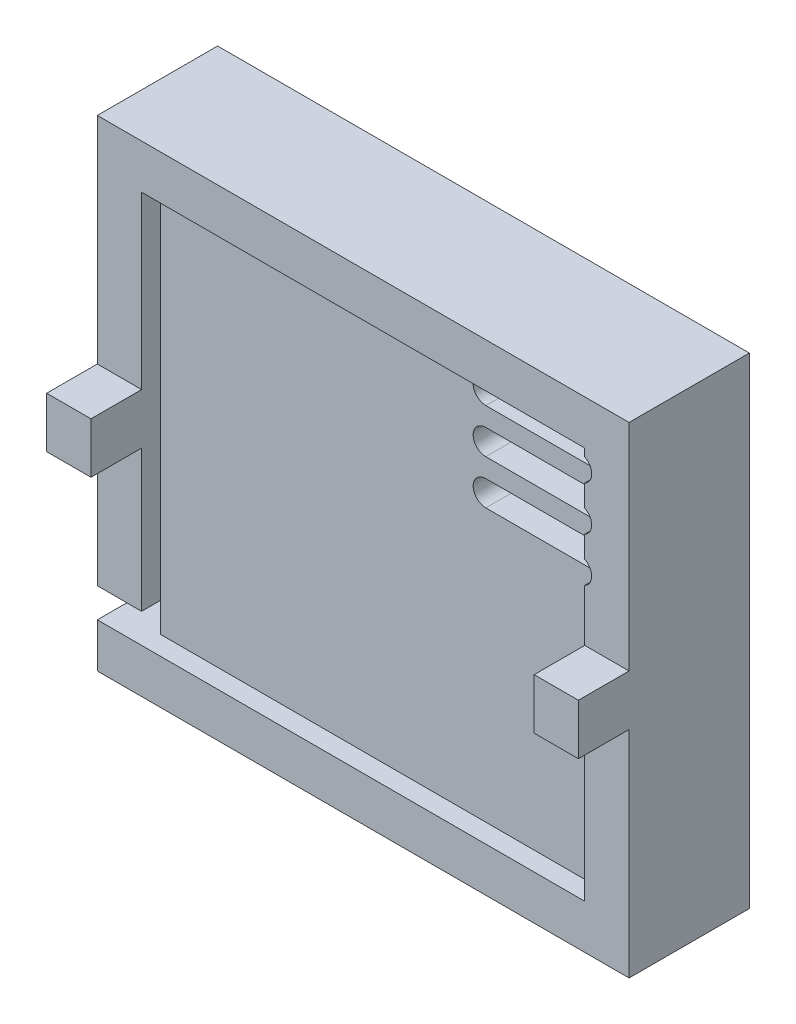
from build123d import *

# Parameters (mm, degrees)
SKETCH_1_W          = 42
SKETCH_1_H          = 38
EXTRUDE_1_DEPTH     = 3.5
SKETCH_2_W          = 3.5
SKETCH_2_H          = 4
EXTRUDE_2_DEPTH     = 4
SKETCH_3_W          = 35
SKETCH_3_H          = 31
CUT_EXTRUDE_1_DEPTH = 1.5
SKETCH_4_W          = 42
SKETCH_4_H          = 38
SKETCH_4_W_2        = 35
SKETCH_4_H_2        = 31
EXTRUDE_3_DEPTH     = 4
SKETCH_6_W          = 42
SKETCH_6_H          = 38
EXTRUDE_4_DEPTH     = 2
SKETCH_7_W          = 4
SKETCH_7_H          = 25
CUT_EXTRUDE_2_DEPTH = 3.5
SKETCH_8_W          = 3.5
SKETCH_8_H          = 2.331830178
CUT_EXTRUDE_3_DEPTH = 3.5
CUT_EXTRUDE_4_DEPTH = 10
SKETCH_10_W         = 1.5
SKETCH_10_H         = 31
EXTRUDE_5_DEPTH     = 5


with BuildPart() as part:
    # 草图1 → 凸台-拉伸1 (new body)
    with BuildSketch(Plane.XY):
        with Locations((21, 19)):
            Rectangle(SKETCH_1_W, SKETCH_1_H)
    extrude(amount=EXTRUDE_1_DEPTH)

    # 草图2 → 凸台-拉伸2 (add)
    with BuildSketch(Plane.XY.offset(3.5)):
        with Locations((1.75, 19)):
            Rectangle(SKETCH_2_W, SKETCH_2_H)
        with Locations((40.25, 19)):
            Rectangle(SKETCH_2_W, SKETCH_2_H)
    extrude(amount=EXTRUDE_2_DEPTH)

    # 草图3 → 切除-拉伸1 (cut)
    with BuildSketch(Plane.XY.offset(3.5)):
        with Locations((21, 19)):
            Rectangle(SKETCH_3_W, SKETCH_3_H)
    extrude(amount=-CUT_EXTRUDE_1_DEPTH, mode=Mode.SUBTRACT)

    # 草图4 → 凸台-拉伸3 (add)
    with BuildSketch(Plane(origin=(0, 0, 0), x_dir=(-1, 0, 0), z_dir=(0, 0, -1))):
        with Locations((-21, 19)):
            Rectangle(SKETCH_4_W, SKETCH_4_H)
        with Locations((-21, 19)):
            Rectangle(SKETCH_4_W_2, SKETCH_4_H_2, mode=Mode.SUBTRACT)
    extrude(amount=EXTRUDE_3_DEPTH)

    # 草图6 → 凸台-拉伸4 (add)
    with BuildSketch(Plane(origin=(0, 0, -4), x_dir=(-1, 0, 0), z_dir=(0, 0, -1))):
        with Locations((-21, 19)):
            Rectangle(SKETCH_6_W, SKETCH_6_H)
    extrude(amount=EXTRUDE_4_DEPTH)

    # 草图7 → 切除-拉伸2 (cut)
    with BuildSketch(Plane.ZY):
        with Locations((-2, 16)):
            Rectangle(SKETCH_7_W, SKETCH_7_H)
    extrude(amount=-CUT_EXTRUDE_2_DEPTH, mode=Mode.SUBTRACT)

    # 草图8 → 切除-拉伸3 (cut)
    with BuildSketch(Plane.ZY):
        with Locations((1.75, 4.665915089)):
            Rectangle(SKETCH_8_W, SKETCH_8_H)
    extrude(amount=-CUT_EXTRUDE_3_DEPTH, mode=Mode.SUBTRACT)

    # 草图9 → 切除-拉伸4 (cut)
    with BuildSketch(Plane(origin=(0, 0, -6), x_dir=(-1, 0, 0), z_dir=(0, 0, -1))):
        with BuildLine():
            Line((-38.044699478, 27), (-29.186779496, 27))
            ThreePointArc((-29.186779496, 27), (-28.186779496, 26), (-29.186779496, 25))
            Line((-29.186779496, 25), (-38.044699478, 25))
            ThreePointArc((-38.044699478, 25), (-39.044699478, 26), (-38.044699478, 27))
        make_face()
        with BuildLine():
            Line((-38.044699478, 30.5), (-29.186779496, 30.5))
            ThreePointArc((-29.186779496, 30.5), (-28.186779496, 29.5), (-29.186779496, 28.5))
            Line((-29.186779496, 28.5), (-38.044699478, 28.5))
            ThreePointArc((-38.044699478, 28.5), (-39.044699478, 29.5), (-38.044699478, 30.5))
        make_face()
        with BuildLine():
            Line((-38.044699478, 34), (-29.186779496, 34))
            ThreePointArc((-29.186779496, 34), (-28.186779496, 33), (-29.186779496, 32))
            Line((-29.186779496, 32), (-38.044699478, 32))
            ThreePointArc((-38.044699478, 32), (-39.044699478, 33), (-38.044699478, 34))
        make_face()
    extrude(amount=-CUT_EXTRUDE_4_DEPTH, mode=Mode.SUBTRACT)

    # 草图10 → 凸台-拉伸5 (add)
    with BuildSketch(Plane(origin=(0, 0, 0), x_dir=(-1, 0, 0), z_dir=(0, 0, -1))):
        with Locations((-27.23390418, 19)):
            Rectangle(SKETCH_10_W, SKETCH_10_H)
    extrude(amount=EXTRUDE_5_DEPTH)


solid = part.part
